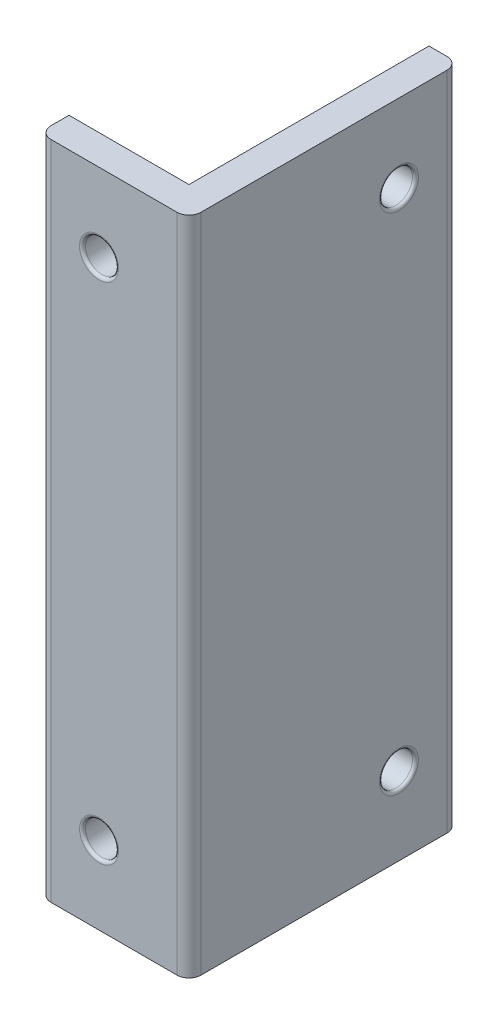
from build123d import *

# Parameters (mm, degrees)
BOSS_EXTRUDE1_DEPTH = 110.14
SKETCH2_R           = 2.75
CUT_EXTRUDE1_DEPTH  = 120.63306232
SKETCH3_R           = 2.75
CUT_EXTRUDE2_DEPTH  = 121.673400549
FILLET1_R           = 0.5
FILLET2_R           = 2


with BuildPart() as part:
    # Sketch1 → Boss-Extrude1 (new body)
    with BuildSketch(Plane(origin=(0, 0, 0), x_dir=(1, 0, 0), z_dir=(0, 1, 0))):
        Polygon((-12.5, -2.5), (12.5, -2.5), (12.5, 2.5), (12.5, 42.5), (7.5, 42.5), (7.5, 2.5), (-12.5, 2.5), align=None)
    extrude(amount=BOSS_EXTRUDE1_DEPTH)

    # Sketch2 → Cut-Extrude1 (cut, through all)
    with BuildSketch(Plane.XY.offset(2.5)):
        with Locations((-2.5, 97.14)):
            Circle(SKETCH2_R)
        with Locations((-2.5, 13)):
            Circle(SKETCH2_R)
    extrude(amount=-CUT_EXTRUDE1_DEPTH, mode=Mode.SUBTRACT)

    # Sketch3 → Cut-Extrude2 (cut, through all)
    with BuildSketch(Plane(origin=(12.5, 0, 0), x_dir=(0, 0, -1), z_dir=(1, 0, 0))):
        with Locations((32.5, 97.14)):
            Circle(SKETCH3_R)
        with Locations((32.5, 13)):
            Circle(SKETCH3_R)
    extrude(amount=-CUT_EXTRUDE2_DEPTH, mode=Mode.SUBTRACT)

    # Fillet1
    fillet1_edges = [part.edges().sort_by_distance(p)[0] for p in [
        (7.5, 97.14, -29.75),
        (12.5, 97.14, -29.75),
        (7.5, 13, -29.75),
        (12.5, 13, -29.75),
        (-5.25, 13, -2.5),
        (-5.25, 13, 2.5),
        (-5.25, 97.14, -2.5),
        (-5.25, 97.14, 2.5),
    ]]
    fillet(fillet1_edges, radius=FILLET1_R)

    # Fillet2
    fillet2_edges = [part.edges().sort_by_distance(p)[0] for p in [
        (12.5, 55.07, -42.5),
        (-12.5, 55.07, 2.5),
        (12.5, 55.07, 2.5),
    ]]
    fillet(fillet2_edges, radius=FILLET2_R)


solid = part.part
